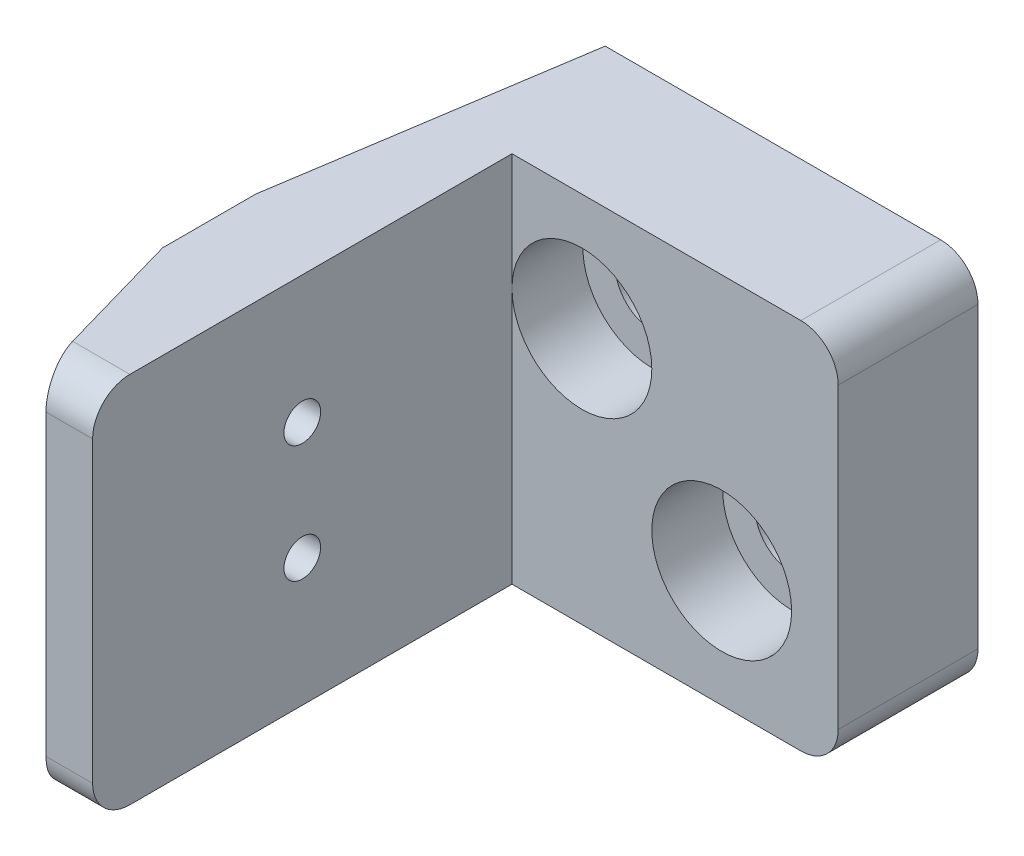
from build123d import *

# Parameters (mm, degrees)
BOSS_EXTRUDE1_DEPTH                             = 25.4
CBORE_FOR_10_SOCKET_HEAD_CAP_SCREW1_D           = 5.1054
CBORE_FOR_10_SOCKET_HEAD_CAP_SCREW1_CBORE_D     = 9.525
CBORE_FOR_10_SOCKET_HEAD_CAP_SCREW1_CBORE_DEPTH = 4.826
M3X0_5_TAPPED_HOLE1_D                           = 2.5
FILLET1_R                                       = 2.54


with BuildPart() as part:
    # Sketch1 → Boss-Extrude1 (new body)
    with BuildSketch(Plane(origin=(0, 0, 0), x_dir=(1, 0, 0), z_dir=(0, 1, 0))):
        Polygon((0, 0), (22.225, 0), (22.225, 9.525), (-3.175, 9.525), (-6.35, -11.1125), (-6.35, -17.4625), (-3.175, -28.575), (0, -28.575), align=None)
    extrude(amount=BOSS_EXTRUDE1_DEPTH)

    # CBORE for #10 Socket Head Cap Screw1 (through all)
    with Locations(Plane.XY):
        with Locations((4.7625, 17.4625), (14.2875, 7.9375)):
            CounterBoreHole(CBORE_FOR_10_SOCKET_HEAD_CAP_SCREW1_D / 2, CBORE_FOR_10_SOCKET_HEAD_CAP_SCREW1_CBORE_D / 2, CBORE_FOR_10_SOCKET_HEAD_CAP_SCREW1_CBORE_DEPTH)

    # M3x0.5 Tapped Hole1 (through all)
    with Locations(Plane(origin=(0, 0, 0), x_dir=(0, 0, -1), z_dir=(1, 0, 0))):
        with Locations((-14.2875, 16.7), (-14.2875, 8.7)):
            Hole(M3X0_5_TAPPED_HOLE1_D / 2)

    # Fillet1
    fillet1_edges = [part.edges().sort_by_distance(p)[0] for p in [
        (-1.5875, 0, 28.575),
        (-1.5875, 25.4, 28.575),
        (22.225, 0, -4.7625),
        (22.225, 25.4, -4.7625),
    ]]
    fillet(fillet1_edges, radius=FILLET1_R)


solid = part.part
